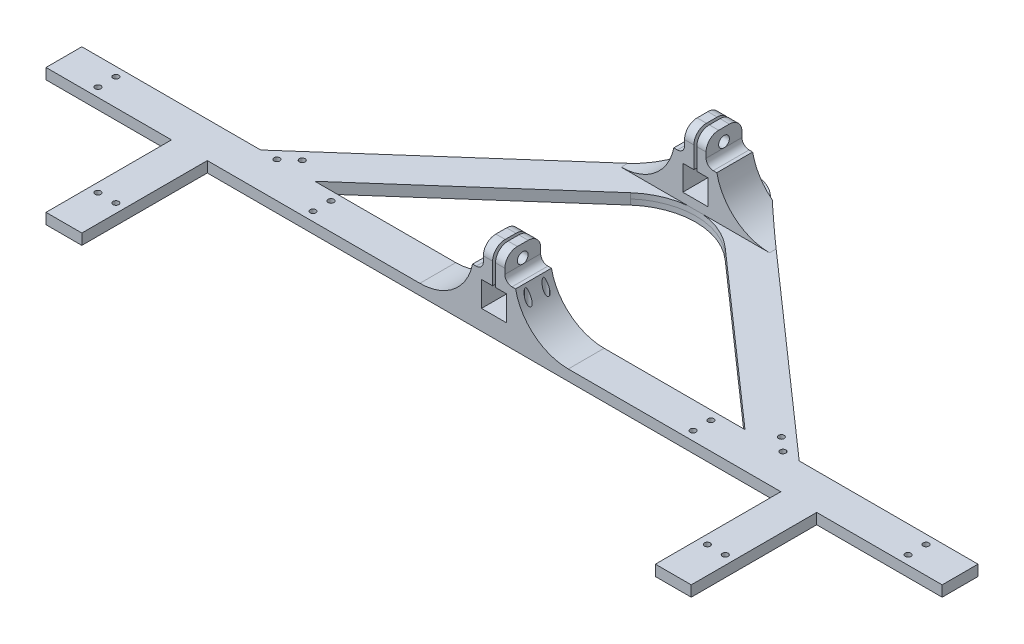
from build123d import *

# Parameters (mm, degrees)
EXTRUDE_1_DEPTH      = 1.5
EXTRUDE_10_DEPTH     = 1.5
FILLET_1_R           = 10
FILLET_2_R           = 20
EXTRUDE_11_DEPTH     = 20
EXTRUDE_13_DEPTH     = 35
EXTRUDE_14_DEPTH     = 35
EXTRUDE_15_DEPTH     = 1.5
FILLET_5_R           = 20
FILLET_6_R           = 10
SKETCH_58_R          = 0.8000000000000042
SKETCH_58_R_2        = 0.8000000000000055
SKETCH_58_R_3        = 0.8000000000000044
SKETCH_58_R_4        = 0.7999999999999963
SKETCH_58_R_5        = 0.8000000000000119
SKETCH_58_R_6        = 0.7999999999999946
SKETCH_58_R_7        = 0.7999999999999954
SKETCH_58_R_8        = 0.7999999999999948
SKETCH_58_R_9        = 0.8000000000000026
CUT_EXTRUDE_52_DEPTH = 145.10569310974057
SKETCH_26_W          = 22
SKETCH_26_H          = 10
EXTRUDE_16_DEPTH     = 20
CUT_EXTRUDE_53_DEPTH = 163.22491745731594
FILLET_7_R           = 15
FILLET_8_R           = 15
FILLET_9_R           = 3.5
SKETCH_60_R          = 1.5000000000000042
CUT_EXTRUDE_54_DEPTH = 147.3444593643323
SKETCH_61_R          = 1.5000000000000004
CUT_EXTRUDE_55_DEPTH = 147.3444593643323
FILLET_10_R          = 2
SKETCH_63_R          = 0.7999999999999954
CUT_EXTRUDE_56_DEPTH = 144.52160390212592


# Some blends are built 0.0001 mm under size
with BuildPart() as part:
    # 草图1 → 凸台-拉伸1 (new body)
    with BuildSketch(Plane(origin=(0, 0, 0), x_dir=(1, 0, 0), z_dir=(0, 1, 0))):
        Polygon((-125, 4.999999999999984), (124.99999999999996, 4.999999999999984), (124.99999999999996, -5.0000000000000115), (-125.00000000000003, -5.0000000000000115), align=None)
    extrude(amount=EXTRUDE_1_DEPTH)



with BuildPart() as body_2:
    # 草图22 → 凸台-拉伸10 (new body)
    with BuildSketch(Plane.XZ):
        Polygon((-3.09e-14, -71.24835955462486), (-3.362e-14, -57.91502622129154), (-60.00000000000021, -4.9999999999999805), (-75.11857892036937, -4.9999999999999805), align=None)
        Polygon((60.00000000000021, -4.9999999999999645), (1.388e-14, -57.91502622129154), (-3.09e-14, -71.24835955462486), (75.1185789203694, -4.999999999999957), align=None)
    extrude(amount=-EXTRUDE_10_DEPTH)

    # 圆角1
    fillet_1_edges = [body_2.edges().sort_by_distance(p)[0] for p in [
        (-8.35e-15, 0.75, -71.24835955462484),
    ]]
    fillet(fillet_1_edges, radius=FILLET_1_R)

    # 圆角2
    fillet_2_edges = [body_2.edges().sort_by_distance(p)[0] for p in [
        (-9.71e-15, 0.75, -57.91502622129154),
    ]]
    fillet(fillet_2_edges, radius=FILLET_2_R)


with BuildPart() as part_1:
    add(part.part)

    add(body_2.part)  # 凸台-拉伸11 merges body 2
    # 草图24 → 凸台-拉伸11 (add)
    with BuildSketch(Plane(origin=(0, 1.5, 0), x_dir=(1, 0, 0), z_dir=(0, 1, 0))):
        Polygon((-10.000000000000004, 4.999999999999999), (9.999999999999996, 4.999999999999999), (9.999999999999996, -5.000000000000001), (-10.000000000000002, -5.000000000000001), align=None)
    extrude(amount=EXTRUDE_11_DEPTH)

    # 草图41 → 凸台-拉伸13 (add)
    with BuildSketch(Plane.XY.offset(5.0000000000000115)):
        Polygon((89.99999999999996, 1.4999999999999951), (79.99999999999996, 1.4999999999999951), (79.99999999999996, -4.88e-15), (89.99999999999996, -4.99e-15), (89.99999999999996, 0.7499999999999958), align=None)
    extrude(amount=EXTRUDE_13_DEPTH)

    # 草图42 → 凸台-拉伸14 (add)
    with BuildSketch(Plane.XY.offset(5.0000000000000115)):
        Polygon((-80, 1.4999999999999998), (-90, 1.4999999999999998), (-90, 0.75), (-90, -2.2e-16), (-80, -2.2e-16), align=None)
    extrude(amount=EXTRUDE_14_DEPTH)

    # 草图57 → 凸台-拉伸15 (add)
    with BuildSketch(Plane(origin=(0, 0, 0), x_dir=(-1, 0, 0), z_dir=(0, -1, 0))):
        Polygon((125.00000000000003, -5.0000000000000115), (90, -5.0000000000000115), (90, -40.000000000000014), (80, -40.000000000000014), (80, -5.0000000000000115), (-79.99999999999996, -5.0000000000000115), (-79.99999999999996, -40.000000000000014), (-89.99999999999996, -40.000000000000014), (-89.99999999999994, -5.0000000000000115), (-124.99999999999996, -5.0000000000000115), (-124.99999999999996, 4.999999999999984), (-75.11857892036936, 4.999999999999984), (-6.614378277661482, 65.41502622129155), (-3.024e-14, 71.24835955462483), (6.614378277661415, 65.41502622129157), (75.11857892036936, 4.999999999999984), (125, 4.999999999999984), align=None)
        Polygon((60.00000000000022, 4.999999999999984), (-60.00000000000011, 4.999999999999984), (-2.082e-14, 57.915026221291534), align=None, mode=Mode.SUBTRACT)
    extrude(amount=EXTRUDE_15_DEPTH)

    # 圆角5
    fillet_5_edges = [part_1.edges().sort_by_distance(p)[0] for p in [
        (2.082e-14, -0.75, -57.915026221291534),
    ]]
    fillet(fillet_5_edges, radius=FILLET_5_R)

    # 圆角6
    fillet_6_edges = [part_1.edges().sort_by_distance(p)[0] for p in [
        (3.024e-14, -0.75, -71.24835955462483),
    ]]
    fillet(fillet_6_edges, radius=FILLET_6_R)

    # 草图58 → 切除-拉伸52 (cut, through all)
    with BuildSketch(Plane.XZ.offset(1.5)):
        with Locations(Location((7, 2.499999999999986, 0), (0, 0, 270))):
            Circle(SKETCH_58_R)
        with Locations(Location((6.999999999999998, -2.5000000000000147, 0), (0, 0, 270))):
            Circle(SKETCH_58_R_2)
        with Locations(Location((53, 2.5000000000000027, 0), (0, 0, 270))):
            Circle(SKETCH_58_R_3)
        with Locations(Location((53.000000000000014, -2.5000000000000027, 0), (0, 0, 270))):
            Circle(SKETCH_58_R_4)
        with Locations(Location((112.99999999999994, 2.5000000000000138, 0), (0, 0, 270))):
            Circle(SKETCH_58_R_5)
        with Locations(Location((112.99999999999997, -2.500000000000007, 0), (0, 0, 270))):
            Circle(SKETCH_58_R_6)
        with Locations(Location((-87.5, 28.000000000000014, 0), (0, 0, 270))):
            Circle(SKETCH_58_R_7)
        with Locations(Location((-82.49999999999999, 28.000000000000007, 0), (0, 0, 270))):
            Circle(SKETCH_58_R_8)
        with Locations(Location((-112.99999999999996, -2.5, 0), (0, 0, 270))):
            Circle(SKETCH_58_R_7)
        with Locations(Location((-112.99999999999996, 2.4999999999999987, 0), (0, 0, 270))):
            Circle(SKETCH_58_R_7)
        with Locations(Location((-53, -2.5, 0), (0, 0, 270))):
            Circle(SKETCH_58_R_9)
        with Locations(Location((-53, 2.5, 0), (0, 0, 270))):
            Circle(SKETCH_58_R_9)
        with Locations(Location((82.49999999999999, 28.000000000000036, 0), (0, 0, 270))):
            Circle(SKETCH_58_R_7)
        with Locations(Location((87.5, 28.000000000000036, 0), (0, 0, 270))):
            Circle(SKETCH_58_R_7)
    extrude(amount=-CUT_EXTRUDE_52_DEPTH, mode=Mode.SUBTRACT)

    # 草图26 → 凸台-拉伸16 (add)
    with BuildSketch(Plane(origin=(0, 1.5, 0), x_dir=(1, 0, 0), z_dir=(0, 1, 0))):
        with Locations((-1.78e-15, 56.141850111775966)):
            Rectangle(SKETCH_26_W, SKETCH_26_H)
    extrude(amount=EXTRUDE_16_DEPTH)

    # 草图59 → 切除-拉伸53 (cut, through all)
    with BuildSketch(Plane(origin=(1.928e-14, 0, -61.14185011177596), x_dir=(-1, 0, -3.2e-16), z_dir=(3.2e-16, 0, -1))):
        Polygon((5.999999999999998, 13.5), (5.999999999999998, 1.5), (11.000000000000021, 1.5), (11.00000000000002, 21.5), (-10.99999999999998, 21.5), (-10.999999999999979, 1.5), (-6, 1.5), (-6.000000000000002, 13.499999999999996), (-3.0000000000000018, 13.499999999999996), (-3.0000000000000018, 20.499999999999996), (-0.40000000000000174, 20.499999999999996), (-1.73e-15, 20.499999999999996), (0.3999999999999983, 20.499999999999996), (2.9999999999999982, 20.499999999999996), (2.9999999999999982, 13.499999999999996), align=None)
        Polygon((-3.5000000000000013, 4.037645071572423), (-1.78e-15, 4.037645071572423), (3.4999999999999982, 4.037645071572423), (3.4999999999999982, 11.037645071572424), (0.927810105733712, 11.037645071572424), (0.3999999999999977, 11.037645071572424), (-1.78e-15, 11.037645071572424), (-0.4000000000000017, 11.037645071572422), (-3.5000000000000018, 11.037645071572422), align=None)
        Polygon((-0.4000000000000018, 13.499999999999996), (-0.4000000000000018, 11.037645071572424), (-1.78e-15, 11.037645071572424), (0.3999999999999977, 11.037645071572424), (0.3999999999999976, 13.499999999999996), (-1.78e-15, 13.499999999999998), align=None)
        Polygon((-0.40000000000000174, 20.499999999999996), (-0.4000000000000018, 13.499999999999996), (-1.78e-15, 13.499999999999998), (-1.73e-15, 20.499999999999996), align=None)
        Polygon((-1.78e-15, 13.499999999999998), (0.3999999999999977, 13.499999999999998), (0.3999999999999983, 20.499999999999996), (-1.73e-15, 20.499999999999996), align=None)
    extrude(amount=-CUT_EXTRUDE_53_DEPTH, mode=Mode.SUBTRACT)

    # 圆角7
    # the kernel refuses this fillet: 15 mm, written as the material it adds along each edge
    with BuildSketch(Plane(origin=(6.0000000000000195, 1.5, -61.14185011177596), x_dir=(1, 0, 3.2e-16), z_dir=(-3.2e-16, 0, 1))) as fillet_7_piece_1_section:
        with BuildLine():
            CenterArc((14.696938456699067, 15), FILLET_7_R, 191.5369590328155, 78.4630409671845)
            Line((1.78e-15, 11.999999999999996), (0, 0))
            Line((0, 0), (14.696938456699067, 0))
        make_face()
    fillet_7_piece_1 = extrude(amount=9.999999999999993, mode=Mode.PRIVATE)
    fillet_7_piece_1 = split(fillet_7_piece_1, bisect_by=Plane(origin=(8.388620739132056, 1.5, -63.85029144843083), z_dir=(-0.6614378277661448, 0, 0.7500000000000027)), keep=Keep.TOP, mode=Mode.PRIVATE)
    add(fillet_7_piece_1)
    with BuildSketch(Plane(origin=(-5.99999999999998, 1.5, -61.14185011177596), x_dir=(-1, 0, -3.2e-16), z_dir=(-3.2e-16, 0, 1))) as fillet_7_piece_2_section:
        with BuildLine():
            CenterArc((14.696938456699073, -15), FILLET_7_R, 90, 78.46304096718453)
            Line((8.9e-16, -12), (0, 0))
            Line((0, 0), (14.696938456699073, 0))
        make_face()
    fillet_7_piece_2 = extrude(amount=9.999999999999993, mode=Mode.PRIVATE)
    fillet_7_piece_2 = split(fillet_7_piece_2, bisect_by=Plane(origin=(-8.388620739132019, 1.5, -63.85029144843084), z_dir=(0.6614378277661446, 0, 0.7500000000000028)), keep=Keep.TOP, mode=Mode.PRIVATE)
    add(fillet_7_piece_2)

    # 圆角8
    # the kernel refuses this fillet: 15 mm, written as the material it adds along each edge
    with BuildSketch(Plane(origin=(6.000000000000002, 1.5, -4.999999999999986), x_dir=(1, 0, 3.2e-16), z_dir=(-3.2e-16, 0, 1))) as fillet_8_piece_1_section:
        with BuildLine():
            CenterArc((14.69693845669907, 15), FILLET_8_R, 191.5369590328155, 78.4630409671845)
            Line((1.78e-15, 11.999999999999996), (0, 0))
            Line((0, 0), (14.69693845669907, 0))
        make_face()
    fillet_8_piece_1 = extrude(amount=9.999999999999993, mode=Mode.PRIVATE)
    fillet_8_piece_1 = fillet_8_piece_1 - Plane(origin=(6.999999999999998, 1.5, -2.5000000000000147), x_dir=(-1.8e-16, 0, -1), z_dir=(0, -1, 0)) * Cylinder(0.8000000000000055, 79, mode=Mode.PRIVATE)
    fillet_8_piece_1 = fillet_8_piece_1 - Plane(origin=(7, 1.5, 2.499999999999986), x_dir=(-1.8e-16, 0, -1), z_dir=(0, -1, 0)) * Cylinder(0.8000000000000042, 79, mode=Mode.PRIVATE)
    add(fillet_8_piece_1)
    with BuildSketch(Plane(origin=(-5.999999999999997, 1.5, -4.999999999999986), x_dir=(-1, 0, -3.2e-16), z_dir=(-3.2e-16, 0, 1))) as fillet_8_piece_2:
        with BuildLine():
            CenterArc((14.696938456699069, -15), FILLET_8_R, 90, 78.4630409671845)
            Line((8.9e-16, -12), (0, 0))
            Line((0, 0), (14.696938456699069, 0))
        make_face()
    extrude(amount=9.999999999999993)

    # 圆角9
    fillet_9_edges = [part_1.edges().sort_by_distance(p)[0] for p in [
        (-1.6999999999999824, 20.499999999999996, -51.141850111775966),
        (1.700000000000018, 20.499999999999996, -51.141850111775966),
        (1.7000000000000028, 20.499999999999996, 5.000000000000009),
        (1.700000000000021, 20.499999999999996, -61.14185011177596),
        (-1.7000000000000028, 20.499999999999996, 5.000000000000009),
        (-1.699999999999979, 20.499999999999996, -61.14185011177596),
        (1.70000000000001, 20.499999999999996, -4.999999999999985),
        (-1.6999999999999957, 20.499999999999996, -4.999999999999985),
    ]]
    fillet(fillet_9_edges, radius=FILLET_9_R)

    # 草图60 → 切除-拉伸54 (cut, through all)
    with BuildSketch(Plane.ZY.offset(2.9999999999999987)):
        with Locations((-56.14185011177597, 16.999999999999996)):
            Circle(SKETCH_60_R)
    extrude(amount=-CUT_EXTRUDE_54_DEPTH, mode=Mode.SUBTRACT)

    # 草图61 → 切除-拉伸55 (cut, through all)
    with BuildSketch(Plane.ZY.offset(2.9999999999999987)):
        with Locations((4.3e-16, 16.999999999999996)):
            Circle(SKETCH_61_R)
    extrude(amount=-CUT_EXTRUDE_55_DEPTH, mode=Mode.SUBTRACT)

    # 圆角10
    fillet_10_edges = [part_1.edges().sort_by_distance(p)[0] for p in [
        (3.0000000000000018, 13.499999999999996, 7.11e-15),
        (3.000000000000019, 13.499999999999996, -56.141850111775966),
        (-2.9999999999999982, 13.499999999999998, 7.11e-15),
        (-2.999999999999981, 13.499999999999998, -56.141850111775966),
    ]]
    fillet(fillet_10_edges, radius=FILLET_10_R - 0.0001)  # a hair under: the kernel refuses the full size

    # 草图63 → 切除-拉伸56 (cut, through all)
    with BuildSketch(Plane(origin=(0, 1.5, 0), x_dir=(1, 0, 0), z_dir=(0, 1, 0))):
        with Locations(Location((70.5830052442586, 4.999999999999985, 0), (0, 0, 270))):
            Circle(SKETCH_63_R)
        with Locations(Location((66.83300524425859, 8.307189138830706, 0), (0, 0, 270))):
            Circle(SKETCH_63_R)
        with Locations(Location((-66.83300524425859, 8.307189138830706, 0), (0, 0, 270))):
            Circle(SKETCH_63_R)
        with Locations(Location((-70.5830052442586, 4.999999999999985, 0), (0, 0, 270))):
            Circle(SKETCH_63_R)
    extrude(amount=-CUT_EXTRUDE_56_DEPTH, mode=Mode.SUBTRACT)


solid = part_1.part
